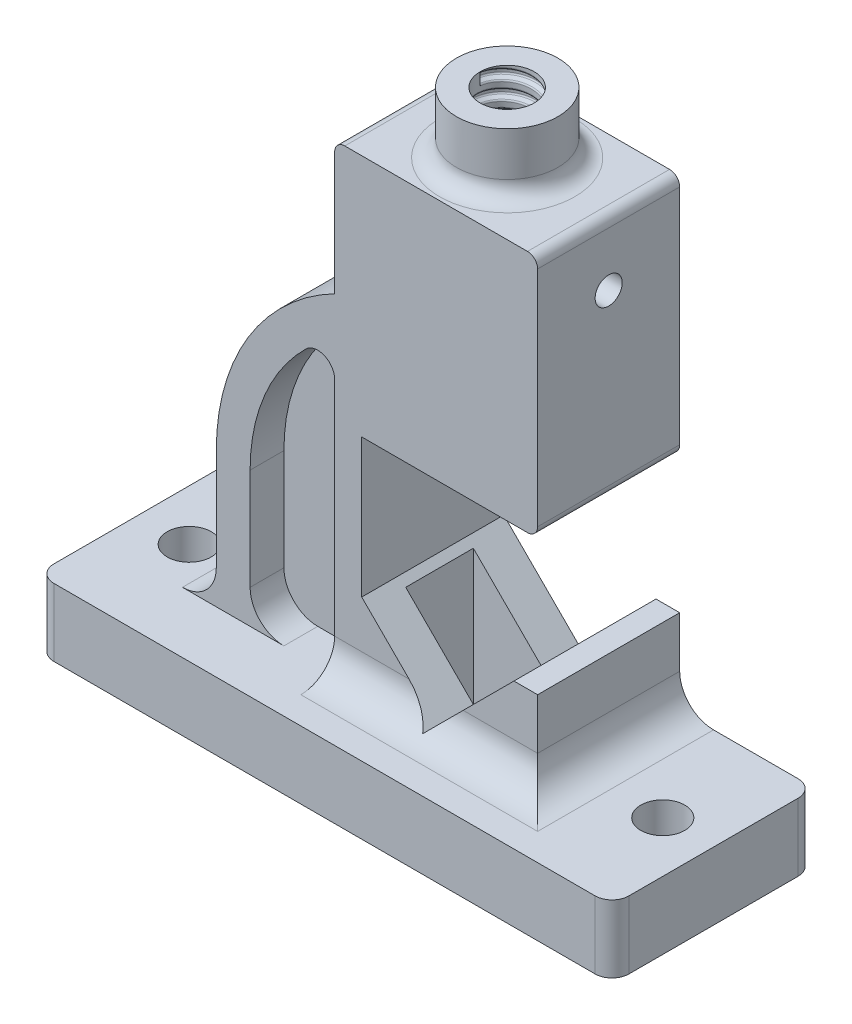
from build123d import *

# Parameters (mm, degrees)
SKETCH1_W           = 170
SKETCH1_H           = 60
BOSS_EXTRUDE1_DEPTH = 20
FILLET2_R           = 5
CUT_EXTRUDE1_REACH  = 94.331
SKETCH2_R           = 6.5
BOSS_EXTRUDE3_START = -30
BOSS_EXTRUDE3_DEPTH = 42
CUT_EXTRUDE3_DEPTH  = 10
BOSS_EXTRUDE4_DEPTH = 21
SKETCH8_R           = 15
SKETCH8_R_2         = 8
BOSS_EXTRUDE5_DEPTH = 18
SKETCH10_W          = 40
SKETCH10_H          = 20
CUT_EXTRUDE4_DEPTH  = 62
CUT_EXTRUDE5_START  = -10
SKETCH8_2_R         = 8
CUT_EXTRUDE5_DEPTH  = 10
SKETCH11_W          = 40
SKETCH11_H          = 20
CUT_EXTRUDE6_DEPTH  = 159.192920196
FILLET3_R           = 5
FILLET9_R           = 10
THREAD3_PITCH       = 5.08
SKETCH12_R          = 4
CUT_EXTRUDE7_DEPTH  = 221.056810926
FILLET10_R          = 3
FILLET11_R          = 3


with BuildPart() as part:
    # Sketch1 → Boss-Extrude1 (new body)
    with BuildSketch(Plane(origin=(0, 0, 0), x_dir=(1, 0, 0), z_dir=(0, 1, 0))):
        Rectangle(SKETCH1_W, SKETCH1_H)
    extrude(amount=BOSS_EXTRUDE1_DEPTH)

    # Fillet2
    fillet2_edges = [part.edges().sort_by_distance(p)[0] for p in [
        (85, 10, 30),
        (-85, 10, 30),
        (-85, 10, -30),
        (85, 10, -30),
    ]]
    fillet(fillet2_edges, radius=FILLET2_R)

    # Sketch2 → Cut-Extrude1 (cut, up to next)
    with BuildSketch(Plane(origin=(0, 20, 0), x_dir=(1, 0, 0), z_dir=(0, 1, 0)), mode=Mode.PRIVATE) as cut_extrude1_sk1:
        with Locations(Location((-70, 0, 0), (0, 0, 270))):
            Circle(SKETCH2_R)
    cut_extrude1_tool1 = extrude(cut_extrude1_sk1.sketch, amount=-CUT_EXTRUDE1_REACH, mode=Mode.PRIVATE) & part.part
    # Sketch2 → Cut-Extrude1 (cut, up to next)
    with BuildSketch(Plane(origin=(0, 20, 0), x_dir=(1, 0, 0), z_dir=(0, 1, 0)), mode=Mode.PRIVATE) as cut_extrude1_sk2:
        with Locations(Location((70, 0, 0), (0, 0, 270))):
            Circle(SKETCH2_R)
    cut_extrude1_tool2 = extrude(cut_extrude1_sk2.sketch, amount=-CUT_EXTRUDE1_REACH, mode=Mode.PRIVATE) & part.part
    add(cut_extrude1_tool1.solids().sort_by_distance((-70, 20, 0))[0], mode=Mode.SUBTRACT)
    add(cut_extrude1_tool2.solids().sort_by_distance((70, 20, 0))[0], mode=Mode.SUBTRACT)

    # Sketch3 → Boss-Extrude3 (add)
    with BuildSketch(Plane.XY.offset(BOSS_EXTRUDE3_START)):
        with BuildLine():
            Line((-7, 20), (-7, 85))
            Line((-7, 85), (45, 85))
            Line((45, 85), (45, 157))
            Line((45, 157), (-15, 157))
            Line((-15, 157), (-15, 117.662812973))
            ThreePointArc((-15, 117.662812973), (-40.565276927, 93.726843908), (-50, 60))
            Line((-50, 60), (-50, 20))
            Line((-50, 20), (-7, 20))
        make_face()
    extrude(amount=BOSS_EXTRUDE3_DEPTH)

    # Sketch4 → Cut-Extrude3 (cut)
    with BuildSketch(Plane.XY.offset(12)):
        with BuildLine():
            Line((-40, 60), (-40, 20))
            Line((-40, 20), (-15, 20))
            Line((-15, 20), (-15, 95.707142143))
            ThreePointArc((-15, 95.707142143), (-18.063508327, 100.316914371), (-23.5, 99.277856357))
            ThreePointArc((-23.5, 99.277856357), (-35.707494515, 81.301408404), (-40, 60))
        make_face()
    cut_extrude3 = extrude(amount=-CUT_EXTRUDE3_DEPTH, mode=Mode.SUBTRACT)

    # Mirror2: Cut-Extrude3 across plane
    add(cut_extrude3.mirror(Plane.XY.offset(-9)), mode=Mode.SUBTRACT)

    # Sketch7 → Boss-Extrude4 (add, symmetric)
    with BuildSketch(Plane.XY.offset(-9)):
        Polygon((15, 22), (38, 45), (45, 45), (45, 20), (-15, 20), (-15, 45), (-8, 45), align=None)
    extrude(amount=BOSS_EXTRUDE4_DEPTH, both=True)

    # Sketch8 → Boss-Extrude5 (add)
    with BuildSketch(Plane(origin=(0, 157, 0), x_dir=(1, 0, 0), z_dir=(0, 1, 0))):
        with Locations(Location((15, 9, 0), (0, 0, 90))):
            Circle(SKETCH8_R)
        with Locations(Location((15, 9, 0), (0, 0, 270))):
            Circle(SKETCH8_R_2, mode=Mode.SUBTRACT)
    extrude(amount=BOSS_EXTRUDE5_DEPTH)

    # Sketch10 → Cut-Extrude4 (cut)
    with BuildSketch(Plane.XZ.offset(-85)):
        with Locations((15, -9)):
            Rectangle(SKETCH10_W, SKETCH10_H)
    extrude(amount=-CUT_EXTRUDE4_DEPTH, mode=Mode.SUBTRACT)

    # Sketch8<2> → Cut-Extrude5 (cut)
    with BuildSketch(Plane(origin=(0, 157, 0), x_dir=(1, 0, 0), z_dir=(0, 1, 0)).offset(CUT_EXTRUDE5_START)):
        with Locations(Location((15, 9, 0), (0, 0, 90))):
            Circle(SKETCH8_2_R)
    extrude(amount=CUT_EXTRUDE5_DEPTH, mode=Mode.SUBTRACT)

    # Sketch11 → Cut-Extrude6 (cut, through all)
    with BuildSketch(Plane(origin=(0, 45, 0), x_dir=(1, 0, 0), z_dir=(0, 1, 0))):
        with Locations((15, 9)):
            Rectangle(SKETCH11_W, SKETCH11_H)
    extrude(amount=-CUT_EXTRUDE6_DEPTH, mode=Mode.SUBTRACT)

    # Fillet3
    fillet3_edges = [part.edges().sort_by_distance(p)[0] for p in [
        (15, 157, 6),
    ]]
    fillet(fillet3_edges, radius=FILLET3_R)

    # Fillet9
    # the kernel refuses this fillet: 10 mm, written as the material it adds along each edge
    with BuildSketch(Plane(origin=(-50, 20, -30), x_dir=(-1, 0, 0), z_dir=(0, 0, 1)), Plane(origin=(45, 20, 12), x_dir=(1, 0, 0), z_dir=(0, 0, -1))) as fillet9_piece_1:
        with BuildLine():
            CenterArc((FILLET9_R, -FILLET9_R), FILLET9_R, 90, 90)
            Line((0, -FILLET9_R), (-FILLET9_R * 0.02, -FILLET9_R))
            Line((-FILLET9_R * 0.02, -FILLET9_R), (-FILLET9_R * 0.02, FILLET9_R * 0.02))
            Line((-FILLET9_R * 0.02, FILLET9_R * 0.02), (FILLET9_R, FILLET9_R * 0.02))
            Line((FILLET9_R, FILLET9_R * 0.02), (FILLET9_R, 0))
        make_face()
    extrude(amount=42)
    with BuildSketch(Plane(origin=(45, 20, 12), x_dir=(0, 1, 0), z_dir=(-1, 0, 0))) as fillet9_piece_2_section:
        with BuildLine():
            CenterArc((FILLET9_R, -FILLET9_R), FILLET9_R, 90, 90)
            Line((0, -FILLET9_R), (-FILLET9_R * 0.02, -FILLET9_R))
            Line((-FILLET9_R * 0.02, -FILLET9_R), (-FILLET9_R * 0.02, FILLET9_R * 0.02))
            Line((-FILLET9_R * 0.02, FILLET9_R * 0.02), (FILLET9_R, FILLET9_R * 0.02))
            Line((FILLET9_R, FILLET9_R * 0.02), (FILLET9_R, 0))
        make_face()
    fillet9_piece_2 = extrude(amount=60, mode=Mode.PRIVATE)
    fillet9_piece_2 = split(fillet9_piece_2, bisect_by=Plane(origin=(23.000083657, 30.000083657, 14.287014667), z_dir=(0.7071067811865465, -0.7071067811865487, 0)), keep=Keep.TOP, mode=Mode.PRIVATE)
    fillet9_piece_2 = split(fillet9_piece_2, bisect_by=Plane(origin=(22.807760418, 14.192239582, 14.287014667), z_dir=(0.7071067811865462, 0.7071067811865489, 0)), keep=Keep.TOP, mode=Mode.PRIVATE)
    add(fillet9_piece_2)
    with BuildSketch(Plane(origin=(45, 20, 12), x_dir=(0, 1, 0), z_dir=(-1, 0, 0))) as fillet9_piece_3_section:
        with BuildLine():
            CenterArc((FILLET9_R, -FILLET9_R), FILLET9_R, 90, 90)
            Line((0, -FILLET9_R), (-FILLET9_R * 0.02, -FILLET9_R))
            Line((-FILLET9_R * 0.02, -FILLET9_R), (-FILLET9_R * 0.02, FILLET9_R * 0.02))
            Line((-FILLET9_R * 0.02, FILLET9_R * 0.02), (FILLET9_R, FILLET9_R * 0.02))
            Line((FILLET9_R, FILLET9_R * 0.02), (FILLET9_R, 0))
        make_face()
    fillet9_piece_3 = extrude(amount=60, mode=Mode.PRIVATE)
    fillet9_piece_3 = split(fillet9_piece_3, bisect_by=Plane(origin=(14.208621879, 21.208621879, 15.739274686), z_dir=(0.7071067811865465, -0.7071067811865487, 0)), keep=Keep.TOP, mode=Mode.PRIVATE)
    fillet9_piece_3 = split(fillet9_piece_3, bisect_by=Plane(origin=(15.791378121, 21.208621879, 15.739274686), z_dir=(-0.7071067811865462, -0.7071067811865489, 0)), keep=Keep.TOP, mode=Mode.PRIVATE)
    add(fillet9_piece_3)
    with BuildSketch(Plane(origin=(45, 20, 12), x_dir=(0, 1, 0), z_dir=(-1, 0, 0))) as fillet9_piece_4_section:
        with BuildLine():
            CenterArc((FILLET9_R, -FILLET9_R), FILLET9_R, 90, 90)
            Line((0, -FILLET9_R), (-FILLET9_R * 0.02, -FILLET9_R))
            Line((-FILLET9_R * 0.02, -FILLET9_R), (-FILLET9_R * 0.02, FILLET9_R * 0.02))
            Line((-FILLET9_R * 0.02, FILLET9_R * 0.02), (FILLET9_R, FILLET9_R * 0.02))
            Line((FILLET9_R, FILLET9_R * 0.02), (FILLET9_R, 0))
        make_face()
    fillet9_piece_4 = extrude(amount=60, mode=Mode.PRIVATE)
    fillet9_piece_4 = split(fillet9_piece_4, bisect_by=Plane(origin=(7.192239582, 14.192239582, 14.287014667), z_dir=(-0.7071067811865465, 0.7071067811865487, 0)), keep=Keep.TOP, mode=Mode.PRIVATE)
    fillet9_piece_4 = split(fillet9_piece_4, bisect_by=Plane(origin=(6.999916343, 30.000083657, 14.287014667), z_dir=(-0.7071067811865462, -0.7071067811865489, 0)), keep=Keep.TOP, mode=Mode.PRIVATE)
    add(fillet9_piece_4)
    with BuildSketch(Plane(origin=(-40, 20, 12), x_dir=(1, 0, 0), z_dir=(0, 0, -1))) as fillet9_piece_5:
        with BuildLine():
            CenterArc((FILLET9_R, -FILLET9_R), FILLET9_R, 90, 90)
            Line((0, -FILLET9_R), (-FILLET9_R * 0.02, -FILLET9_R))
            Line((-FILLET9_R * 0.02, -FILLET9_R), (-FILLET9_R * 0.02, FILLET9_R * 0.02))
            Line((-FILLET9_R * 0.02, FILLET9_R * 0.02), (FILLET9_R, FILLET9_R * 0.02))
            Line((FILLET9_R, FILLET9_R * 0.02), (FILLET9_R, 0))
        make_face()
    extrude(amount=10)
    with BuildSketch(Plane(origin=(70, 20, 12), x_dir=(0, 1, 0), z_dir=(-1, 0, 0))) as fillet9_piece_6a_section:
        with BuildLine():
            CenterArc((FILLET9_R, -FILLET9_R), FILLET9_R, 90, 90)
            Line((0, -FILLET9_R), (-FILLET9_R * 0.02, -FILLET9_R))
            Line((-FILLET9_R * 0.02, -FILLET9_R), (-FILLET9_R * 0.02, FILLET9_R * 0.02))
            Line((-FILLET9_R * 0.02, FILLET9_R * 0.02), (FILLET9_R, FILLET9_R * 0.02))
            Line((FILLET9_R, FILLET9_R * 0.02), (FILLET9_R, 0))
        make_face()
    fillet9_piece_6a = extrude(amount=85, mode=Mode.PRIVATE)
    fillet9_piece_6a = split(fillet9_piece_6a, bisect_by=Plane(origin=(45, 22.263951143, 14.263951143), z_dir=(1, 0, 0)), keep=Keep.TOP, mode=Mode.PRIVATE)
    with BuildSketch(Plane(origin=(45, 20, 37), x_dir=(1, 0, 0), z_dir=(0, 0, -1))) as fillet9_piece_6b_section:
        with BuildLine():
            CenterArc((FILLET9_R, -FILLET9_R), FILLET9_R, 90, 90)
            Line((0, -FILLET9_R), (-FILLET9_R * 0.02, -FILLET9_R))
            Line((-FILLET9_R * 0.02, -FILLET9_R), (-FILLET9_R * 0.02, FILLET9_R * 0.02))
            Line((-FILLET9_R * 0.02, FILLET9_R * 0.02), (FILLET9_R, FILLET9_R * 0.02))
            Line((FILLET9_R, FILLET9_R * 0.02), (FILLET9_R, 0))
        make_face()
    fillet9_piece_6b = extrude(amount=67, mode=Mode.PRIVATE)
    fillet9_piece_6b = split(fillet9_piece_6b, bisect_by=Plane(origin=(47.263951143, 22.263951143, 12), z_dir=(0, 0, 1)), keep=Keep.TOP, mode=Mode.PRIVATE)
    fillet9_piece_6b = split(fillet9_piece_6b, bisect_by=Plane(origin=(47.263951143, 22.263951143, 30), z_dir=(0, 0, -1)), keep=Keep.TOP, mode=Mode.PRIVATE)
    fillet9_piece_6 = fillet9_piece_6a & fillet9_piece_6b
    add(fillet9_piece_6)

    # Thread3: the profile of Thread Profile4 profile screwed along a right-hand helix of 5.511811 turns, 12 arcs to a turn; built about Z, then put on its axis
    thread3_z = Axis((0, 0, 0), (0, 0, 1))
    thread3_corners = [(7.9997, 0, 0), (7.9997, 0, 3.634587873), (8, 0, 3.634587873), (8.254, 0, 3.194646968), (9.27, 0, 2.608059095), (9.524, 0, 2.16811819), (9.524, 0, 1.466469684), (9.27, 0, 1.026528779), (8.254, 0, 0.439940905), (8, 0, 0)]
    with BuildLine(mode=Mode.PRIVATE) as thread3_profile:
        Line(thread3_corners[0], thread3_corners[1])
        Line(thread3_corners[3], thread3_corners[4])
        Line(thread3_corners[5], thread3_corners[6])
        Line(thread3_corners[7], thread3_corners[8])
        Line(thread3_corners[9], thread3_corners[0])
        Line(thread3_corners[2], thread3_corners[1])
        ThreePointArc((8, 0, 3.634587873), (8.068059095, 0, 3.380587873), (8.254, 0, 3.194646968))
        ThreePointArc((9.27, 0, 2.608059095), (9.455940905, 0, 2.42211819), (9.524, 0, 2.16811819))
        ThreePointArc((9.524, 0, 1.466469684), (9.455940905, 0, 1.212469684), (9.27, 0, 1.026528779))
        ThreePointArc((8.254, 0, 0.439940905), (8.068059095, 0, 0.254), (8, 0, 0))
    thread3_cap = Face(thread3_profile.wire())
    thread3_arcs = [((8, 0, 3.634587873), (8, 0, 3.341293937), (8.254, 0, 3.194646968), (1, 0.866025403784437, 1)), ((9.27, 0, 2.608059095), (9.524, 0, 2.461412127), (9.524, 0, 2.16811819), (1, 0.8660254037844378, 1)), ((9.524, 0, 1.466469684), (9.524, 0, 1.173175747), (9.27, 0, 1.026528779), (1, 0.8660254037844376, 1)), ((8.254, 0, 0.439940905), (8, 0, 0.293293937), (8, 0, 0), (1, 0.8660254037844366, 1))]  # start, shoulder, end, weights
    thread3_turn_angles = [0, 15, 30, 45, 60, 75, 90, 105, 120, 135, 150, 165, 180, 195, 210, 225, 240, 255, 270, 285, 300, 315, 330, 345, 360]
    thread3_turn_weights = [1, 0.9659258262890683, 1, 0.9659258262890683, 1, 0.9659258262890683, 1, 0.9659258262890683, 1, 0.9659258262890683, 1, 0.9659258262890683, 1, 0.9659258262890683, 1, 0.9659258262890683, 1, 0.9659258262890683, 1, 0.9659258262890683, 1, 0.9659258262890683, 1, 0.9659258262890683, 1]
    thread3_turn_rails = [Edge.make_bspline([Vector(p[0], p[1], 0).rotate(thread3_z, thread3_turn_angles[k]) / thread3_turn_weights[k] + Vector(0, 0, p[2] + THREAD3_PITCH * thread3_turn_angles[k] / 360) for k in range(25)], [0, 0, 0, 1, 1, 2, 2, 3, 3, 4, 4, 5, 5, 6, 6, 7, 7, 8, 8, 9, 9, 10, 10, 11, 11, 12, 12, 12], 2, thread3_turn_weights) for p in thread3_corners]
    thread3_turn_sides = [*[Face.make_surface_from_curves(thread3_turn_rails[p[0]], thread3_turn_rails[p[1]]) for p in [(0, 1), (3, 4), (5, 6), (7, 8), (9, 0), (2, 1)]], *[Face.make_bezier_surface([[Vector(p[j][0], p[j][1], 0).rotate(thread3_z, thread3_turn_angles[2 * i + k]) / thread3_turn_weights[2 * i + k] + Vector(0, 0, p[j][2] + THREAD3_PITCH * thread3_turn_angles[2 * i + k] / 360) for k in range(3)] for j in range(3)], [[p[3][j] * thread3_turn_weights[2 * i + k] for k in range(3)] for j in range(3)]) for p in thread3_arcs for i in range(12)]]
    thread3_last_angles = [1800, 1815, 1830, 1845, 1860, 1875, 1890, 1905, 1920, 1935, 1950, 1965, 1980, 1982.125984252, 1984.251968504]
    thread3_last_weights = [1, 0.9659258262890683, 1, 0.9659258262890683, 1, 0.9659258262890683, 1, 0.9659258262890683, 1, 0.9659258262890683, 1, 0.9659258262890683, 1, 0.9993116726964553, 1]
    thread3_last_rails = [Edge.make_bspline([Vector(p[0], p[1], 0).rotate(thread3_z, thread3_last_angles[k]) / thread3_last_weights[k] + Vector(0, 0, p[2] + THREAD3_PITCH * thread3_last_angles[k] / 360) for k in range(15)], [0, 0, 0, 1, 1, 2, 2, 3, 3, 4, 4, 5, 5, 6, 6, 7, 7, 7], 2, thread3_last_weights) for p in thread3_corners]
    thread3_last_sides = [*[Face.make_surface_from_curves(thread3_last_rails[p[0]], thread3_last_rails[p[1]]) for p in [(0, 1), (3, 4), (5, 6), (7, 8), (9, 0), (2, 1)]], *[Face.make_bezier_surface([[Vector(p[j][0], p[j][1], 0).rotate(thread3_z, thread3_last_angles[2 * i + k]) / thread3_last_weights[2 * i + k] + Vector(0, 0, p[j][2] + THREAD3_PITCH * thread3_last_angles[2 * i + k] / 360) for k in range(3)] for j in range(3)], [[p[3][j] * thread3_last_weights[2 * i + k] for k in range(3)] for j in range(3)]) for p in thread3_arcs for i in range(7)]]
    thread3 = Plane(origin=(15, 175, -9), x_dir=(-1, 0, 0), z_dir=(0, -1, 0)) * Solid(Shell([*[p.moved(Location((0, 0, THREAD3_PITCH * i))) for i in range(5) for p in thread3_turn_sides], *thread3_last_sides, thread3_cap, thread3_cap.rotate(thread3_z, 1984.251968504).moved(Location((0, 0, THREAD3_PITCH * 1984.251968504 / 360)))]))
    add(thread3, mode=Mode.SUBTRACT)

    # Sketch12 → Cut-Extrude7 (cut, through all)
    with BuildSketch(Plane(origin=(45, 0, 0), x_dir=(0, 0, -1), z_dir=(1, 0, 0))):
        with Locations((9, 138)):
            Circle(SKETCH12_R)
    extrude(amount=-CUT_EXTRUDE7_DEPTH, mode=Mode.SUBTRACT)

    # Fillet10
    fillet10_edges = [part.edges().sort_by_distance(p)[0] for p in [
        (45, 157, -9),
        (-15, 157, -9),
    ]]
    fillet(fillet10_edges, radius=FILLET10_R)

    # Fillet11
    fillet11_edges = [part.edges().sort_by_distance(p)[0] for p in [
        (45, 85, -9),
    ]]
    fillet(fillet11_edges, radius=FILLET11_R)


solid = part.part
